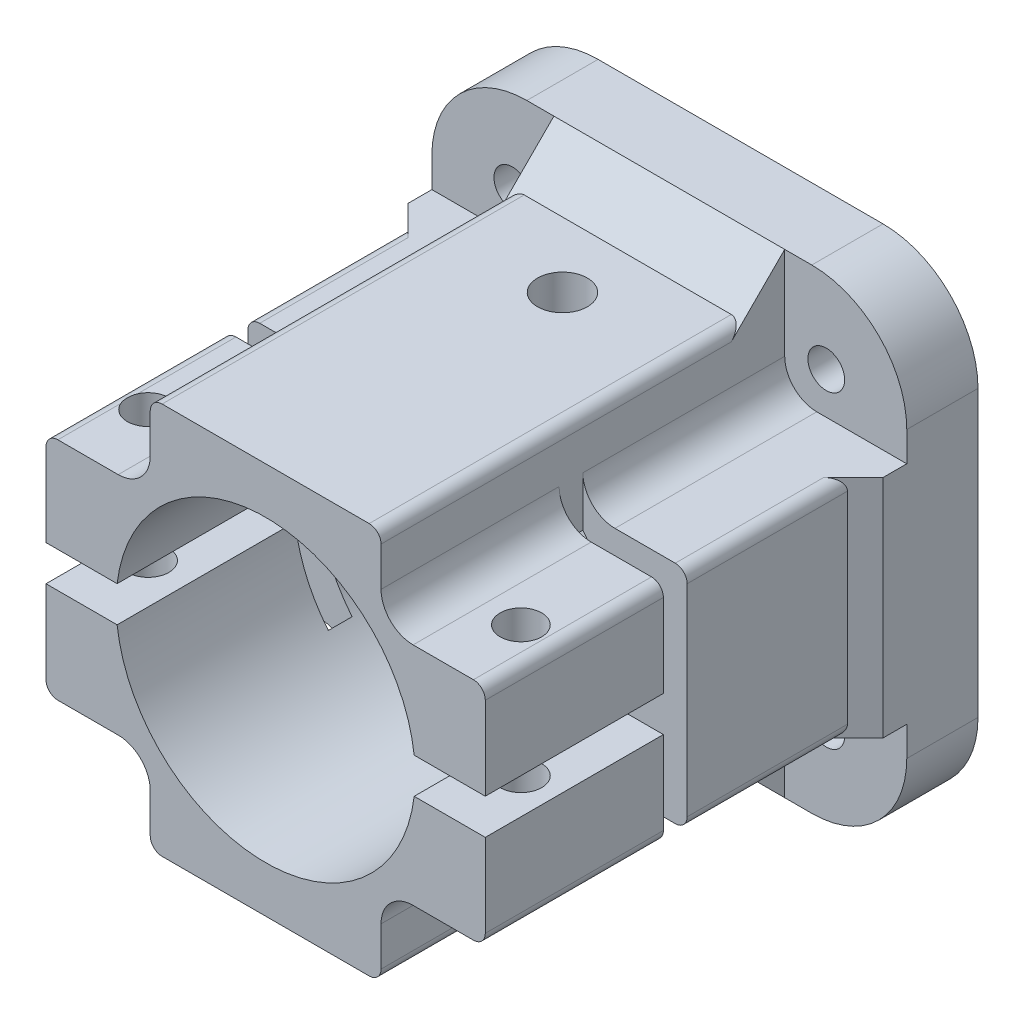
from build123d import *

# Parameters (mm, degrees)
SKETCH_1_W          = 40
SKETCH_1_H          = 40
SKETCH_1_R          = 1.55
SKETCH_1_R_2        = 12.5
EXTRUDE_1_DEPTH     = 6
SKETCH_2_R          = 12.5
EXTRUDE_2_DEPTH     = 34
SKETCH_4_R          = 1.75
CUT_EXTRUDE_1_DEPTH = 54.574714185
CHAMFER_1_SIZE      = 3.5
CHAMFER_2_SIZE      = 3.5
FILLET_3_R          = 2.7
FILLET_4_R          = 8
SKETCH_5_R          = 12.5
EXTRUDE_3_DEPTH     = 3
SKETCH_6_R          = 1.55
CUT_EXTRUDE_2_DEPTH = 47.572524089
EXTRUDE_START       = 1.5
SKETCH_8_R          = 3
SKETCH_8_R_2        = 1.55
EXTRUDE_4_DEPTH     = 1.5
SKETCH_9_W          = 44.762954336
SKETCH_9_H          = 3
CUT_EXTRUDE_3_DEPTH = 15
CUT_EXTRUDE_4_REACH = 61.011
SKETCH_10_W         = 2
SKETCH_10_H         = 29
SKETCH_11_W         = 2
SKETCH_11_H         = 29.746931438
CUT_EXTRUDE_5_DEPTH = 8.78
FILLET_5_R          = 1
SKETCH_12_R         = 2.1
CUT_EXTRUDE_6_DEPTH = 58.725644284
CUT_EXTRUDE_7_REACH = 52.222
SKETCH_14_R         = 12.6


# Some blends are built 0.0001 mm under size
with BuildPart() as part:
    # 草图1 → 凸台-拉伸1 (new body)
    with BuildSketch(Plane.XY):
        Rectangle(SKETCH_1_W, SKETCH_1_H)
        with Locations((-13.22, 13)):
            Circle(SKETCH_1_R, mode=Mode.SUBTRACT)
        Circle(SKETCH_1_R_2, mode=Mode.SUBTRACT)
        with Locations(Location((13.22, 13, 0), (0, 0, 180))):
            Circle(SKETCH_1_R, mode=Mode.SUBTRACT)
        with Locations((13.22, -13)):
            Circle(SKETCH_1_R, mode=Mode.SUBTRACT)
        with Locations(Location((-13.22, -13, 0), (0, 0, 180))):
            Circle(SKETCH_1_R, mode=Mode.SUBTRACT)
    extrude(amount=EXTRUDE_1_DEPTH)

    # 草图2 → 凸台-拉伸2 (add)
    with BuildSketch(Plane.XY.offset(6)):
        Polygon((-9.72, 9.5), (-9.72, 16.5), (9.72, 16.5), (9.72, 9.5), (18.5, 9.5), (18.5, -9.5), (9.72, -9.5), (9.72, -16.5), (-9.72, -16.5), (-9.72, -9.5), (-18.5, -9.5), (-18.5, 9.5), align=None)
        Circle(SKETCH_2_R, mode=Mode.SUBTRACT)
    extrude(amount=EXTRUDE_2_DEPTH)

    # 草图4 → 切除-拉伸1 (cut, through all)
    with BuildSketch(Plane(origin=(0, 9.5, 0), x_dir=(1, 0, 0), z_dir=(0, 1, 0))):
        with Locations(Location((-15.9, -34, 0), (0, 0, 180))):
            Circle(SKETCH_4_R)
        with Locations(Location((15.5, -34, 0), (0, 0, 180))):
            Circle(SKETCH_4_R)
    extrude(amount=-CUT_EXTRUDE_1_DEPTH, mode=Mode.SUBTRACT)

    # 倒角1
    chamfer_1_edges = [part.edges().sort_by_distance(p)[0] for p in [
        (0, 16.5, 6),
        (0, -16.5, 6),
    ]]
    chamfer(chamfer_1_edges, length=CHAMFER_1_SIZE - 0.0001)  # a hair under: the kernel refuses the full size

    # 倒角2
    # the kernel refuses this chamfer: 3.5 mm, written as the material it adds along each edge
    with BuildSketch(Plane(origin=(-18.5, -9.5, 6), x_dir=(-0.9996219169112968, 0, -0.027495876610586372), z_dir=(0, 1, 0))) as chamfer_2_piece_1_section:
        Polygon((CHAMFER_2_SIZE * 0.999621916911, CHAMFER_2_SIZE * 0.0274958766106), (-CHAMFER_2_SIZE * 0.0274958766106, CHAMFER_2_SIZE * 0.999621916911), (0, 0), align=None)
    chamfer_2_piece_1 = extrude(amount=19, mode=Mode.PRIVATE)
    chamfer_2_piece_1 = split(chamfer_2_piece_1, bisect_by=Plane(origin=(-20, 0, 7.427398354), z_dir=(1, 0, 0)), keep=Keep.TOP, mode=Mode.PRIVATE)
    add(chamfer_2_piece_1)
    with BuildSketch(Plane(origin=(18.5, 9.5, 6), x_dir=(0.9996219169112968, 0, -0.027495876610586372), z_dir=(0, -1, 0))) as chamfer_2_piece_2_section:
        Polygon((CHAMFER_2_SIZE * 0.999621916911, CHAMFER_2_SIZE * 0.0274958766106), (-CHAMFER_2_SIZE * 0.0274958766106, CHAMFER_2_SIZE * 0.999621916911), (0, 0), align=None)
    chamfer_2_piece_2 = extrude(amount=19, mode=Mode.PRIVATE)
    chamfer_2_piece_2 = split(chamfer_2_piece_2, bisect_by=Plane(origin=(20, 0, 7.427398354), z_dir=(-1, 0, 0)), keep=Keep.TOP, mode=Mode.PRIVATE)
    add(chamfer_2_piece_2)

    # 圆角3
    fillet_3_edges = [part.edges().sort_by_distance(p)[0] for p in [
        (9.72, 9.5, 23),
        (-9.72, 9.5, 23),
        (-9.72, -9.5, 23),
        (9.72, -9.5, 23),
    ]]
    fillet(fillet_3_edges, radius=FILLET_3_R)

    # 圆角4
    fillet_4_edges = [part.edges().sort_by_distance(p)[0] for p in [
        (20, -20, 3),
        (-20, -20, 3),
        (-20, 20, 3),
        (20, 20, 3),
    ]]
    fillet(fillet_4_edges, radius=FILLET_4_R)

    # 草图5 → 凸台-拉伸3 (add)
    with BuildSketch(Plane(origin=(0, 0, 0), x_dir=(-1, 0, 0), z_dir=(0, 0, -1))):
        Circle(SKETCH_5_R)
    extrude(amount=-EXTRUDE_3_DEPTH)

    # 草图6 → 切除-拉伸2 (cut, through all)
    with BuildSketch(Plane.XY.offset(3)):
        with Locations((0, 4)):
            Circle(SKETCH_6_R)
        with Locations((0, -4)):
            Circle(SKETCH_6_R)
    extrude(amount=-CUT_EXTRUDE_2_DEPTH, mode=Mode.SUBTRACT)

    # 草图8 → 凸台-拉伸4 (add)
    # profile 1 of 4: a face of its own
    with BuildSketch(Plane(origin=(0, 0, 0), x_dir=(-1, 0, 0), z_dir=(0, 0, -1)).offset(EXTRUDE_START)):
        with Locations((-13.22, 13)):
            Circle(SKETCH_8_R)
        with Locations((-13.22, 13)):
            Circle(SKETCH_8_R_2, mode=Mode.SUBTRACT)
    # profile 2 of 4: a face of its own
    with BuildSketch(Plane(origin=(0, 0, 0), x_dir=(-1, 0, 0), z_dir=(0, 0, -1)).offset(EXTRUDE_START)):
        with Locations((13.22, 13)):
            Circle(SKETCH_8_R)
        with Locations((13.22, 13)):
            Circle(SKETCH_8_R_2, mode=Mode.SUBTRACT)
    # profile 3 of 4: a face of its own
    with BuildSketch(Plane(origin=(0, 0, 0), x_dir=(-1, 0, 0), z_dir=(0, 0, -1)).offset(EXTRUDE_START)):
        with Locations((-13.22, -13)):
            Circle(SKETCH_8_R)
        with Locations((-13.22, -13)):
            Circle(SKETCH_8_R_2, mode=Mode.SUBTRACT)
    # profile 4 of 4: a face of its own
    with BuildSketch(Plane(origin=(0, 0, 0), x_dir=(-1, 0, 0), z_dir=(0, 0, -1)).offset(EXTRUDE_START)):
        with Locations((13.22, -13)):
            Circle(SKETCH_8_R)
        with Locations((13.22, -13)):
            Circle(SKETCH_8_R_2, mode=Mode.SUBTRACT)
    extrude(amount=-EXTRUDE_4_DEPTH)

    # 草图9 → 切除-拉伸3 (cut)
    with BuildSketch(Plane.XY.offset(40)):
        with Locations((1.135123066, 0)):
            Rectangle(SKETCH_9_W, SKETCH_9_H)
    extrude(amount=-CUT_EXTRUDE_3_DEPTH, mode=Mode.SUBTRACT)

    # 切除-拉伸4: up to this face of the body (flat: up to its plane)
    cut_extrude_4_end = Plane(part.part.faces().sort_by_distance((-9.72, 14.483354768, 22.363374022))[0])
    # 草图10 → 切除-拉伸4 (cut, up to the picked face)
    with BuildSketch(Plane.ZY.offset(18.5), mode=Mode.PRIVATE) as cut_extrude_4_sk1:
        with Locations((24, 0)):
            Rectangle(SKETCH_10_W, SKETCH_10_H)
    cut_extrude_4_tool1 = split(extrude(cut_extrude_4_sk1.sketch, amount=-CUT_EXTRUDE_4_REACH, mode=Mode.PRIVATE), bisect_by=cut_extrude_4_end, keep=Keep.BOTH, mode=Mode.PRIVATE)
    add(cut_extrude_4_tool1.solids().sort_by(Axis((-18.5, 0, 24), (1, 0, 0)))[0], mode=Mode.SUBTRACT)

    # 草图11 → 切除-拉伸5 (cut)
    with BuildSketch(Plane(origin=(18.5, 0, 0), x_dir=(0, 0, -1), z_dir=(1, 0, 0))):
        with Locations((-24, 0.373465719)):
            Rectangle(SKETCH_11_W, SKETCH_11_H)
    extrude(amount=-CUT_EXTRUDE_5_DEPTH, mode=Mode.SUBTRACT)

    # 圆角5
    # the kernel refuses this fillet: 1 mm, written as the material it takes off along each edge
    with BuildSketch(Plane(origin=(-18.5, -9.5, 7), x_dir=(1, 0, 0), z_dir=(0, 0, 1))) as fillet_5_piece_1_section:
        with BuildLine():
            CenterArc((FILLET_5_R, FILLET_5_R), FILLET_5_R, 180, 90)
            Line((0, FILLET_5_R), (0, 0))
            Line((0, 0), (FILLET_5_R, 0))
        make_face()
    fillet_5_piece_1 = extrude(amount=18.5, mode=Mode.PRIVATE)
    fillet_5_piece_1 = split(fillet_5_piece_1, bisect_by=Plane(origin=(-14.332413526, -9.271864211, 13.667586474), z_dir=(-0.7071067811868302, 0, 0.7071067811862649)), keep=Keep.TOP, mode=Mode.PRIVATE)
    add(fillet_5_piece_1, mode=Mode.SUBTRACT)
    with BuildSketch(Plane(origin=(-18.5, 9.5, 7), x_dir=(1, 0, 0), z_dir=(0, 0, 1))) as fillet_5_piece_2_section:
        with BuildLine():
            CenterArc((FILLET_5_R, -FILLET_5_R), FILLET_5_R, 90, 90)
            Line((0, -FILLET_5_R), (0, 0))
            Line((0, 0), (FILLET_5_R, 0))
        make_face()
    fillet_5_piece_2 = extrude(amount=18.5, mode=Mode.PRIVATE)
    fillet_5_piece_2 = split(fillet_5_piece_2, bisect_by=Plane(origin=(-14.332413526, 9.271864211, 13.667586474), z_dir=(-0.7071067811868302, 0, 0.7071067811862649)), keep=Keep.TOP, mode=Mode.PRIVATE)
    add(fillet_5_piece_2, mode=Mode.SUBTRACT)
    with BuildSketch(Plane(origin=(18.5, -9.5, 7), x_dir=(-1, 0, 0), z_dir=(0, 0, 1))) as fillet_5_piece_3_section:
        with BuildLine():
            CenterArc((FILLET_5_R, -FILLET_5_R), FILLET_5_R, 90, 90)
            Line((0, -FILLET_5_R), (0, 0))
            Line((0, 0), (FILLET_5_R, 0))
        make_face()
    fillet_5_piece_3 = extrude(amount=18.5, mode=Mode.PRIVATE)
    fillet_5_piece_3 = split(fillet_5_piece_3, bisect_by=Plane(origin=(14.332413526, -9.271864211, 13.667586474), z_dir=(0.7071067811868302, 0, 0.7071067811862649)), keep=Keep.TOP, mode=Mode.PRIVATE)
    add(fillet_5_piece_3, mode=Mode.SUBTRACT)
    with BuildSketch(Plane(origin=(18.5, 9.5, 7), x_dir=(-1, 0, 0), z_dir=(0, 0, 1))) as fillet_5_piece_4_section:
        with BuildLine():
            CenterArc((FILLET_5_R, FILLET_5_R), FILLET_5_R, 180, 90)
            Line((0, FILLET_5_R), (0, 0))
            Line((0, 0), (FILLET_5_R, 0))
        make_face()
    fillet_5_piece_4 = extrude(amount=18.5, mode=Mode.PRIVATE)
    fillet_5_piece_4 = split(fillet_5_piece_4, bisect_by=Plane(origin=(14.332413526, 9.271864211, 13.667586474), z_dir=(0.7071067811868302, 0, 0.7071067811862649)), keep=Keep.TOP, mode=Mode.PRIVATE)
    add(fillet_5_piece_4, mode=Mode.SUBTRACT)
    with BuildSketch(Plane(origin=(18.5, 9.5, 22.5), x_dir=(0, -1, 0), z_dir=(0, 0, 1)), Plane(origin=(-18.5, -9.5, 22.5), x_dir=(0, 1, 0), z_dir=(0, 0, 1)), Plane(origin=(18.5, -9.5, 22.5), x_dir=(-1, 0, 0), z_dir=(0, 0, 1))) as fillet_5_piece_5:
        with BuildLine():
            CenterArc((FILLET_5_R, -FILLET_5_R), FILLET_5_R, 90, 90)
            Line((0, -FILLET_5_R), (0, 0))
            Line((0, 0), (FILLET_5_R, 0))
        make_face()
    extrude(amount=20, mode=Mode.SUBTRACT)
    with BuildSketch(Plane(origin=(9.72, 16.5, 6.9999), x_dir=(0, -1, 0), z_dir=(0, 0, 1))) as fillet_5_piece_6_section:
        with BuildLine():
            CenterArc((FILLET_5_R, -FILLET_5_R), FILLET_5_R, 90, 90)
            Line((0, -FILLET_5_R), (0, 0))
            Line((0, 0), (FILLET_5_R, 0))
        make_face()
    fillet_5_piece_6 = extrude(amount=35.5001, mode=Mode.PRIVATE)
    fillet_5_piece_6 = split(fillet_5_piece_6, bisect_by=Plane(origin=(9.492767119, 8.081242245, 17.918657755), z_dir=(0, 0.7071067811865476, 0.7071067811865476)), keep=Keep.TOP, mode=Mode.PRIVATE)
    add(fillet_5_piece_6, mode=Mode.SUBTRACT)
    with BuildSketch(Plane(origin=(-9.72, 16.5, 6.9999), x_dir=(0, -1, 0), z_dir=(0, 0, 1))) as fillet_5_piece_7_section:
        with BuildLine():
            CenterArc((FILLET_5_R, FILLET_5_R), FILLET_5_R, 180, 90)
            Line((0, FILLET_5_R), (0, 0))
            Line((0, 0), (FILLET_5_R, 0))
        make_face()
    fillet_5_piece_7 = extrude(amount=35.5001, mode=Mode.PRIVATE)
    fillet_5_piece_7 = split(fillet_5_piece_7, bisect_by=Plane(origin=(-9.492767119, 8.081242245, 17.918657755), z_dir=(0, 0.7071067811865476, 0.7071067811865476)), keep=Keep.TOP, mode=Mode.PRIVATE)
    add(fillet_5_piece_7, mode=Mode.SUBTRACT)
    with BuildSketch(Plane(origin=(-18.5, 9.5, 22.5), x_dir=(0, -1, 0), z_dir=(0, 0, 1))) as fillet_5_piece_8:
        with BuildLine():
            CenterArc((FILLET_5_R, FILLET_5_R), FILLET_5_R, 180, 90)
            Line((0, FILLET_5_R), (0, 0))
            Line((0, 0), (FILLET_5_R, 0))
        make_face()
    extrude(amount=20, mode=Mode.SUBTRACT)
    with BuildSketch(Plane(origin=(-9.72, -16.5, 6.9999), x_dir=(0, 1, 0), z_dir=(0, 0, 1))) as fillet_5_piece_9_section:
        with BuildLine():
            CenterArc((FILLET_5_R, -FILLET_5_R), FILLET_5_R, 90, 90)
            Line((0, -FILLET_5_R), (0, 0))
            Line((0, 0), (FILLET_5_R, 0))
        make_face()
    fillet_5_piece_9 = extrude(amount=35.5001, mode=Mode.PRIVATE)
    fillet_5_piece_9 = split(fillet_5_piece_9, bisect_by=Plane(origin=(-9.492767119, -8.081242245, 17.918657755), z_dir=(0, -0.7071067811865476, 0.7071067811865476)), keep=Keep.TOP, mode=Mode.PRIVATE)
    add(fillet_5_piece_9, mode=Mode.SUBTRACT)
    with BuildSketch(Plane(origin=(9.72, -16.5, 6.9999), x_dir=(0, 1, 0), z_dir=(0, 0, 1))) as fillet_5_piece_10_section:
        with BuildLine():
            CenterArc((FILLET_5_R, FILLET_5_R), FILLET_5_R, 180, 90)
            Line((0, FILLET_5_R), (0, 0))
            Line((0, 0), (FILLET_5_R, 0))
        make_face()
    fillet_5_piece_10 = extrude(amount=35.5001, mode=Mode.PRIVATE)
    fillet_5_piece_10 = split(fillet_5_piece_10, bisect_by=Plane(origin=(9.492767119, -8.081242245, 17.918657755), z_dir=(0, -0.7071067811865476, 0.7071067811865476)), keep=Keep.TOP, mode=Mode.PRIVATE)
    add(fillet_5_piece_10, mode=Mode.SUBTRACT)

    # 草图12 → 切除-拉伸6 (cut, through all)
    with BuildSketch(Plane(origin=(0, 16.5, 0), x_dir=(1, 0, 0), z_dir=(0, 1, 0))):
        with Locations(Location((0, -15, 0), (0, 0, 270))):
            Circle(SKETCH_12_R)
    extrude(amount=-CUT_EXTRUDE_6_DEPTH, mode=Mode.SUBTRACT)

    # 切除-拉伸7: up to this face of the body (flat: up to its plane)
    cut_extrude_7_end = Plane(part.part.faces().sort_by_distance((0, 0, 3))[0])
    # 草图14 → 切除-拉伸7 (cut, up to the picked face)
    with BuildSketch(Plane.XY.offset(40), mode=Mode.PRIVATE) as cut_extrude_7_sk1:
        with Locations(Location((0, 0, 0), (0, 0, 6.837141168))):
            Circle(SKETCH_14_R)
    cut_extrude_7_tool1 = split(extrude(cut_extrude_7_sk1.sketch, amount=-CUT_EXTRUDE_7_REACH, mode=Mode.PRIVATE), bisect_by=cut_extrude_7_end, keep=Keep.BOTH, mode=Mode.PRIVATE)
    add(cut_extrude_7_tool1.solids().sort_by(Axis((0, 0, 40), (0, 0, -1)))[0], mode=Mode.SUBTRACT)


solid = part.part
